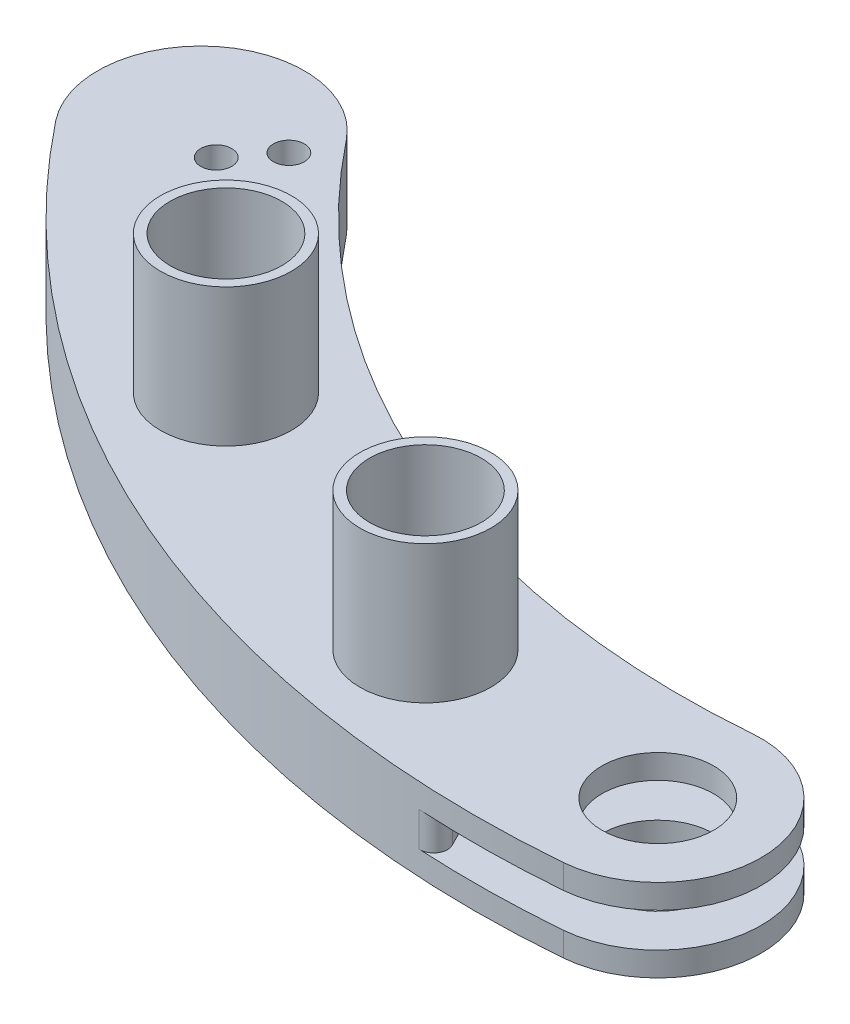
from build123d import *

# Parameters (mm, degrees)
BOSS_EXTRUDE4_DEPTH = 11.999999999999996
BOSS_EXTRUDE5_DEPTH = 3.5
BOSS_EXTRUDE6_DEPTH = 12
CUT_EXTRUDE2_DEPTH  = 8.5
BOSS_EXTRUDE7_DEPTH = 3.5000000000000004
SKETCH2_R           = 8.1
CUT_EXTRUDE3_DEPTH  = 12
FILLET1_R           = 5
FILLET2_R           = 2
SKETCH3_R           = 2.2499999999999964
CUT_EXTRUDE4_DEPTH  = 12
SKETCH4_R           = 9.500000000000002
SKETCH4_R_2         = 8.1
SKETCH4_R_3         = 9.499999999999995
SKETCH4_R_4         = 8.099999999999993
BOSS_EXTRUDE8_DEPTH = 20


with BuildPart() as part:
    # Sketch1 → Boss-Extrude4 (new body)
    with BuildSketch(Plane(origin=(0, 0, 0), x_dir=(1, 0, 0), z_dir=(0, 1, 0))):
        with BuildLine():
            ThreePointArc((-105.23956914411866, 60.05130546378884), (-126.31086817026393, 62.500868149406244), (-128.76043085588134, 41.429569123260976))
            ThreePointArc((-128.76043085588134, 41.42956912326096), (-78.3921989201775, 0.4513014224205847), (-15.424890802752289, -15.400995588922257))
            ThreePointArc((-15.424890802752284, -15.400995588922251), (-20.878753235246265, -0.5691494549701637), (-16.67921047602729, 14.665420305521598))
            ThreePointArc((-16.679210476027265, 14.665420305521593), (-65.8857769449076, 27.74562513419724), (-105.23956914411866, 60.05130546378885))
        make_face()
    extrude(amount=BOSS_EXTRUDE4_DEPTH)

    # Sketch1<6> → Boss-Extrude5 (add)
    with BuildSketch(Plane(origin=(0, 0, 0), x_dir=(1, 0, 0), z_dir=(0, 1, 0))):
        with BuildLine():
            ThreePointArc((-16.67921047602729, 14.665420305521598), (-20.878753235246265, -0.5691494549701637), (-15.424890802752284, -15.400995588922251))
            ThreePointArc((-15.424890802752289, -15.400995588922257), (-7.086372530747029, -15.406529466177687), (1.2395691441186596, -14.94869453621115))
            ThreePointArc((1.2395691441186607, -14.948694536211157), (14.948694536211152, 1.2395691441186514), (-1.2395691441186483, 14.948694536211152))
            ThreePointArc((-1.2395691441186347, 14.94869453621115), (-8.954828429393212, 14.55844291928571), (-16.679210476027265, 14.665420305521593))
        make_face()
    extrude(amount=BOSS_EXTRUDE5_DEPTH)

    # Sketch1<8> → Boss-Extrude6 (add)
    with BuildSketch(Plane(origin=(0, 0, 0), x_dir=(1, 0, 0), z_dir=(0, 1, 0))):
        with BuildLine():
            ThreePointArc((-16.67921047602729, 14.665420305521598), (-20.878753235246265, -0.5691494549701637), (-15.424890802752284, -15.400995588922251))
            ThreePointArc((-15.424890802752289, -15.400995588922257), (-7.086372530747029, -15.406529466177687), (1.2395691441186596, -14.94869453621115))
            ThreePointArc((1.2395691441186607, -14.948694536211157), (14.948694536211152, 1.2395691441186514), (-1.2395691441186483, 14.948694536211152))
            ThreePointArc((-1.2395691441186347, 14.94869453621115), (-8.954828429393212, 14.55844291928571), (-16.679210476027265, 14.665420305521593))
        make_face()
    extrude(amount=BOSS_EXTRUDE6_DEPTH)

    # Sketch1<9> → Cut-Extrude2 (cut)
    with BuildSketch(Plane(origin=(0, 0, 0), x_dir=(1, 0, 0), z_dir=(0, 1, 0))):
        with BuildLine():
            ThreePointArc((-16.67921047602729, 14.665420305521598), (-20.878753235246265, -0.5691494549701637), (-15.424890802752284, -15.400995588922251))
            ThreePointArc((-15.424890802752289, -15.400995588922257), (-7.086372530747029, -15.406529466177687), (1.2395691441186596, -14.94869453621115))
            ThreePointArc((1.2395691441186607, -14.948694536211157), (14.948694536211152, 1.2395691441186514), (-1.2395691441186483, 14.948694536211152))
            ThreePointArc((-1.2395691441186347, 14.94869453621115), (-8.954828429393212, 14.55844291928571), (-16.679210476027265, 14.665420305521593))
        make_face()
    extrude(amount=CUT_EXTRUDE2_DEPTH, mode=Mode.SUBTRACT)

    # Sketch1<10> → Boss-Extrude7 (add)
    with BuildSketch(Plane(origin=(0, 0, 0), x_dir=(1, 0, 0), z_dir=(0, 1, 0))):
        with BuildLine():
            ThreePointArc((-16.67921047602729, 14.665420305521598), (-20.878753235246265, -0.5691494549701637), (-15.424890802752284, -15.400995588922251))
            ThreePointArc((-15.424890802752289, -15.400995588922257), (-7.086372530747029, -15.406529466177687), (1.2395691441186596, -14.94869453621115))
            ThreePointArc((1.2395691441186607, -14.948694536211157), (14.948694536211152, 1.2395691441186514), (-1.2395691441186483, 14.948694536211152))
            ThreePointArc((-1.2395691441186347, 14.94869453621115), (-8.954828429393212, 14.55844291928571), (-16.679210476027265, 14.665420305521593))
        make_face()
    extrude(amount=BOSS_EXTRUDE7_DEPTH)

    # Sketch2 → Cut-Extrude3 (cut)
    with BuildSketch(Plane(origin=(0, 11.999999999999996, 0), x_dir=(1, 0, 0), z_dir=(0, 1, 0))):
        Circle(SKETCH2_R)
    extrude(amount=-CUT_EXTRUDE3_DEPTH, mode=Mode.SUBTRACT)

    # Fillet1
    fillet1_edges = [part.edges().sort_by_distance(p)[0] for p in [
        (-16.67921047602728, 6, -14.665420305521597),
    ]]
    fillet(fillet1_edges, radius=FILLET1_R)

    # Fillet2
    fillet2_edges = [part.edges().sort_by_distance(p)[0] for p in [
        (-15.424890802752289, 6, 15.400995588922266),
    ]]
    fillet(fillet2_edges, radius=FILLET2_R)

    # Sketch3 → Cut-Extrude4 (cut)
    with BuildSketch(Plane(origin=(0, 11.999999999999996, 0), x_dir=(1, 0, 0), z_dir=(0, 1, 0))):
        with Locations((-107.81660725396851, 54.30249040498051)):
            Circle(SKETCH3_R)
        with Locations((-112.49908312253997, 48.44378579216329)):
            Circle(SKETCH3_R)
    extrude(amount=-CUT_EXTRUDE4_DEPTH, mode=Mode.SUBTRACT)

    # Sketch4 → Boss-Extrude8 (add)
    # profile 1 of 2: a face of its own
    with BuildSketch(Plane(origin=(0, 11.999999999999996, 0), x_dir=(1, 0, 0), z_dir=(0, 1, 0))):
        with Locations((-35.51993478051481, 1.811997227050931)):
            Circle(SKETCH4_R)
        with Locations((-35.51993478051481, 1.811997227050931)):
            Circle(SKETCH4_R_2, mode=Mode.SUBTRACT)
    # profile 2 of 2: a face of its own
    with BuildSketch(Plane(origin=(0, 11.999999999999996, 0), x_dir=(1, 0, 0), z_dir=(0, 1, 0))):
        with Locations((-82.24716798080135, 19.60428986869888)):
            Circle(SKETCH4_R_3)
        with Locations((-82.24716798080135, 19.60428986869888)):
            Circle(SKETCH4_R_4, mode=Mode.SUBTRACT)
    extrude(amount=BOSS_EXTRUDE8_DEPTH)


solid = part.part
